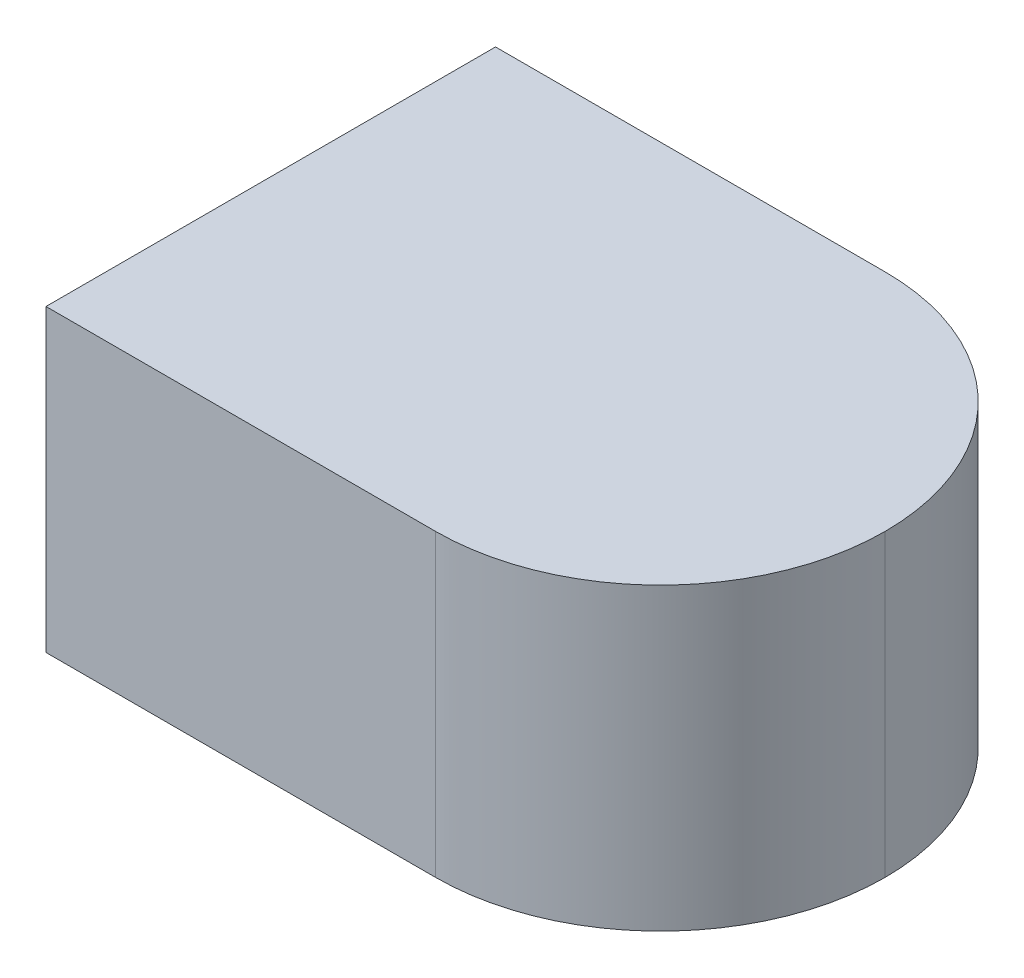
from build123d import *

# Parameters (mm, degrees)
SKETCH1_W           = 0.41
SKETCH1_H           = 0.3
BOSS_EXTRUDE1_DEPTH = 0.2
FILLET1_R           = 0.15


with BuildPart() as part:
    # Sketch1 → Boss-Extrude1 (new body)
    with BuildSketch(Plane(origin=(0, 0, 0), x_dir=(1, 0, 0), z_dir=(0, 1, 0))):
        Rectangle(SKETCH1_W, SKETCH1_H)
    extrude(amount=BOSS_EXTRUDE1_DEPTH)

    # Fillet1
    # the kernel refuses this fillet: 0.15 mm, written as the material it takes off along each edge
    with BuildSketch(Plane(origin=(0.205, -0.375, -0.15), x_dir=(0, 0, 1), z_dir=(0, 1, 0)), Plane(origin=(0.205, -0.375, 0.15), x_dir=(-1, 0, 0), z_dir=(0, 1, 0))) as fillet1_piece_1:
        with BuildLine():
            CenterArc((FILLET1_R, -FILLET1_R), FILLET1_R, 90, 90)
            Line((0, -FILLET1_R), (0, 0))
            Line((0, 0), (FILLET1_R, 0))
        make_face()
    extrude(amount=0.95, mode=Mode.SUBTRACT)


solid = part.part
